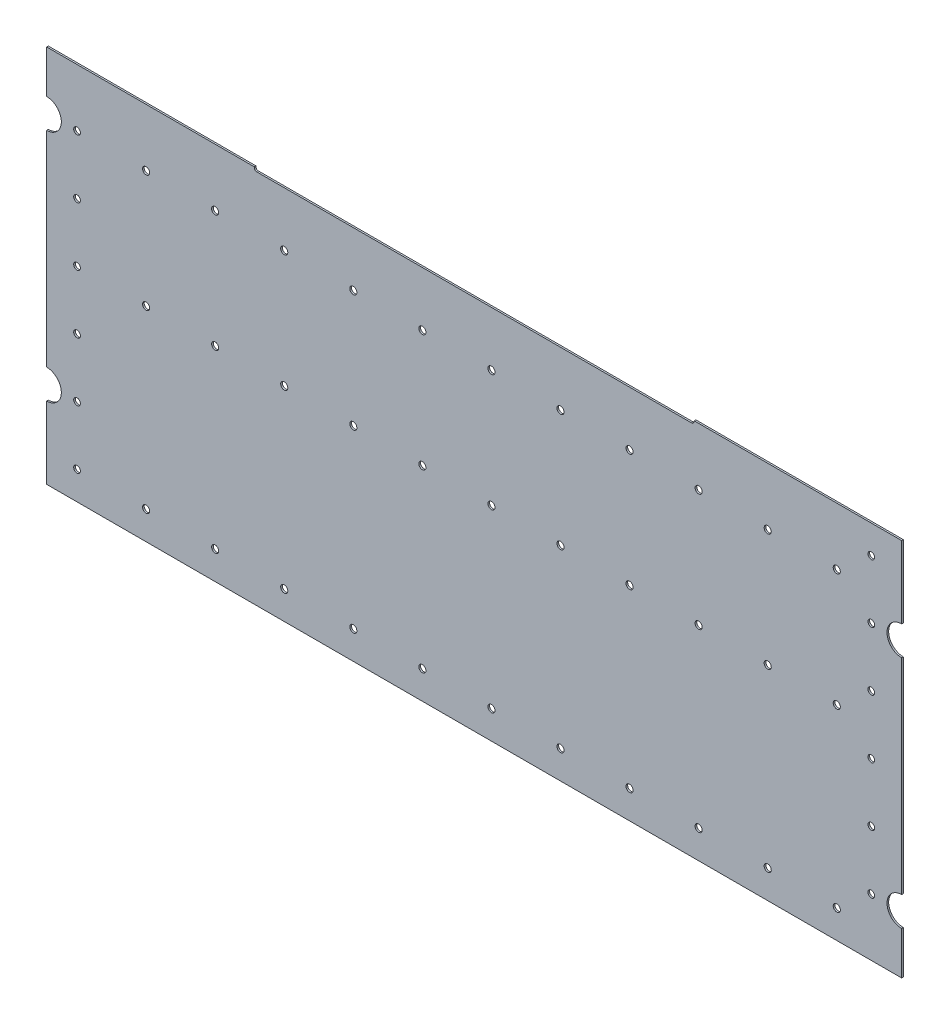
from build123d import *

# Parameters (mm, degrees)
ESQUISSE2_W                = 409.5
ESQUISSE2_H                = 182
BOSS_EXTRU_2_DEPTH         = 0.79375
ESQUISSE3_R                = 1.7
ENL_V_MAT_EXTRU_1_DEPTH    = 225.062920938
R_P_TITION_LIN_AIRE1_COUNT = 11
R_P_TITION_LIN_AIRE1_PITCH = 33
ESQUISSE4_W                = 210
ESQUISSE4_H                = 2
ENL_V_MAT_EXTRU_2_DEPTH    = 225.062920938
CONG_1_R                   = 1
ESQUISSE5_OUTSIDE_W        = 501.124
ESQUISSE5_OUTSIDE_H        = 273.624
ESQUISSE5_OUTSIDE_W_2      = 408.5
ESQUISSE5_OUTSIDE_H_2      = 181
ENL_V_MAT_EXTRU_3_DEPTH    = 225.062920938
D_GAGEMENT_M31_D           = 3.2
ENL_V_MAT_EXTRU_4_REACH    = 225.403


with BuildPart() as part:
    # Esquisse2 → Boss.-Extru.2 (new body)
    with BuildSketch(Plane.XY):
        Rectangle(ESQUISSE2_W, ESQUISSE2_H)
    extrude(amount=BOSS_EXTRU_2_DEPTH)

    # Esquisse3 → Enlèv. mat.-Extru.1 (cut, through all)
    with BuildSketch(Plane.XY.offset(0.79375)):
        with Locations((-156.75, 63)):
            Circle(ESQUISSE3_R)
        with Locations((-156.75, 7)):
            Circle(ESQUISSE3_R)
        with Locations((-156.75, -77)):
            Circle(ESQUISSE3_R)
    enl_v_mat_extru_1 = extrude(amount=-ENL_V_MAT_EXTRU_1_DEPTH, mode=Mode.SUBTRACT)

    # Répétition linéaire1: Enlèv. mat.-Extru.1 ×11
    with Locations(*[(i * R_P_TITION_LIN_AIRE1_PITCH, 0, 0) for i in range(1, R_P_TITION_LIN_AIRE1_COUNT)]):
        add(enl_v_mat_extru_1, mode=Mode.SUBTRACT)

    # Esquisse4 → Enlèv. mat.-Extru.2 (cut, through all)
    with BuildSketch(Plane(origin=(0, 0, 0), x_dir=(-1, 0, 0), z_dir=(0, 0, -1))):
        with Locations((0, 90)):
            Rectangle(ESQUISSE4_W, ESQUISSE4_H)
    extrude(amount=-ENL_V_MAT_EXTRU_2_DEPTH, mode=Mode.SUBTRACT)

    # Congé1
    cong_1_edges = [part.edges().sort_by_distance(p)[0] for p in [
        (-105, 89, 0.396875),
        (105, 89, 0.396875),
    ]]
    fillet(cong_1_edges, radius=CONG_1_R)
    cong_1_2_edges = [part.edges().sort_by_distance(p)[0] for p in [
        (-105, 91, 0.396875),
        (105, 91, 0.396875),
    ]]
    fillet(cong_1_2_edges, radius=CONG_1_R - 0.0001)  # a hair under: the kernel refuses the full size

    # Esquisse5 outside → Enlèv. mat.-Extru.3 (cut, through all)
    with BuildSketch(Plane(origin=(0, 0, 0), x_dir=(-1, 0, 0), z_dir=(0, 0, -1))):
        Rectangle(ESQUISSE5_OUTSIDE_W, ESQUISSE5_OUTSIDE_H)
        Rectangle(ESQUISSE5_OUTSIDE_W_2, ESQUISSE5_OUTSIDE_H_2, mode=Mode.SUBTRACT)
    extrude(amount=-ENL_V_MAT_EXTRU_3_DEPTH, mode=Mode.SUBTRACT)

    # Dégagement M31 (through all)
    with Locations(Plane(origin=(0, 0, 0), x_dir=(-1, 0, 0), z_dir=(0, 0, -1))):
        with Locations((-189.75, 77), (-189.75, 49), (-189.75, 21), (-189.75, -7), (-189.75, -35), (-189.75, -63), (189.75, 63), (189.75, 35), (189.75, 7), (189.75, -21), (189.75, -49), (189.75, -77)):
            Hole(D_GAGEMENT_M31_D / 2)

    # Esquisse14 → Enlèv. mat.-Extru.4 (cut, up to next)
    with BuildSketch(Plane(origin=(0, 0, 0), x_dir=(-1, 0, 0), z_dir=(0, 0, -1)), mode=Mode.PRIVATE) as enl_v_mat_extru_4_sk1:
        with BuildLine():
            Line((-204.25, -56), (-204.25, -70))
            ThreePointArc((-204.25, -70), (-197.25, -63), (-204.25, -56))
        make_face()
    enl_v_mat_extru_4_tool1 = extrude(enl_v_mat_extru_4_sk1.sketch, amount=-ENL_V_MAT_EXTRU_4_REACH, mode=Mode.PRIVATE) & part.part
    # Esquisse14 → Enlèv. mat.-Extru.4 (cut, up to next)
    with BuildSketch(Plane(origin=(0, 0, 0), x_dir=(-1, 0, 0), z_dir=(0, 0, -1)), mode=Mode.PRIVATE) as enl_v_mat_extru_4_sk2:
        with BuildLine():
            Line((-204.25, 56), (-204.25, 42))
            ThreePointArc((-204.25, 42), (-197.25, 49), (-204.25, 56))
        make_face()
    enl_v_mat_extru_4_tool2 = extrude(enl_v_mat_extru_4_sk2.sketch, amount=-ENL_V_MAT_EXTRU_4_REACH, mode=Mode.PRIVATE) & part.part
    # Esquisse14 → Enlèv. mat.-Extru.4 (cut, up to next)
    with BuildSketch(Plane(origin=(0, 0, 0), x_dir=(-1, 0, 0), z_dir=(0, 0, -1)), mode=Mode.PRIVATE) as enl_v_mat_extru_4_sk3:
        with BuildLine():
            Line((204.25, 70), (204.25, 56))
            ThreePointArc((204.25, 56), (197.25, 63), (204.25, 70))
        make_face()
    enl_v_mat_extru_4_tool3 = extrude(enl_v_mat_extru_4_sk3.sketch, amount=-ENL_V_MAT_EXTRU_4_REACH, mode=Mode.PRIVATE) & part.part
    # Esquisse14 → Enlèv. mat.-Extru.4 (cut, up to next)
    with BuildSketch(Plane(origin=(0, 0, 0), x_dir=(-1, 0, 0), z_dir=(0, 0, -1)), mode=Mode.PRIVATE) as enl_v_mat_extru_4_sk4:
        with BuildLine():
            Line((204.25, -42), (204.25, -56))
            ThreePointArc((204.25, -56), (197.25, -49), (204.25, -42))
        make_face()
    enl_v_mat_extru_4_tool4 = extrude(enl_v_mat_extru_4_sk4.sketch, amount=-ENL_V_MAT_EXTRU_4_REACH, mode=Mode.PRIVATE) & part.part
    add(enl_v_mat_extru_4_tool1.solids().sort_by_distance((201.279108, -63, 0))[0], mode=Mode.SUBTRACT)
    add(enl_v_mat_extru_4_tool2.solids().sort_by_distance((201.279108, 49, 0))[0], mode=Mode.SUBTRACT)
    add(enl_v_mat_extru_4_tool3.solids().sort_by_distance((-201.279108, 63, 0))[0], mode=Mode.SUBTRACT)
    add(enl_v_mat_extru_4_tool4.solids().sort_by_distance((-201.279108, -49, 0))[0], mode=Mode.SUBTRACT)


solid = part.part
